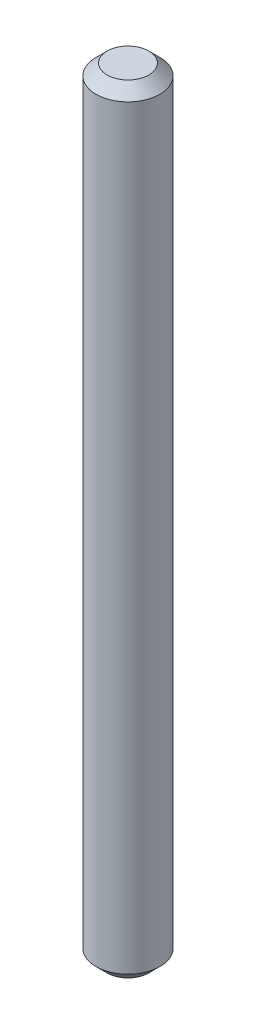
from build123d import *

# Parameters (mm, degrees)
SKETCH1_R           = 2.875
BOSS_EXTRUDE1_DEPTH = 35
CHAMFER1_SIZE       = 1


with BuildPart() as part:
    # Sketch1 → Boss-Extrude1 (new, symmetric)
    with BuildSketch(Plane(origin=(0, 0, 0), x_dir=(1, 0, 0), z_dir=(0, 1, 0))):
        Circle(SKETCH1_R)
    extrude(amount=BOSS_EXTRUDE1_DEPTH, both=True)

    # Chamfer1
    chamfer1_edges = [part.edges().sort_by_distance(p)[0] for p in [
        (-2.875, -35, 0),
        (-2.875, 35, 0),
    ]]
    chamfer(chamfer1_edges, length=CHAMFER1_SIZE)


solid = part.part
